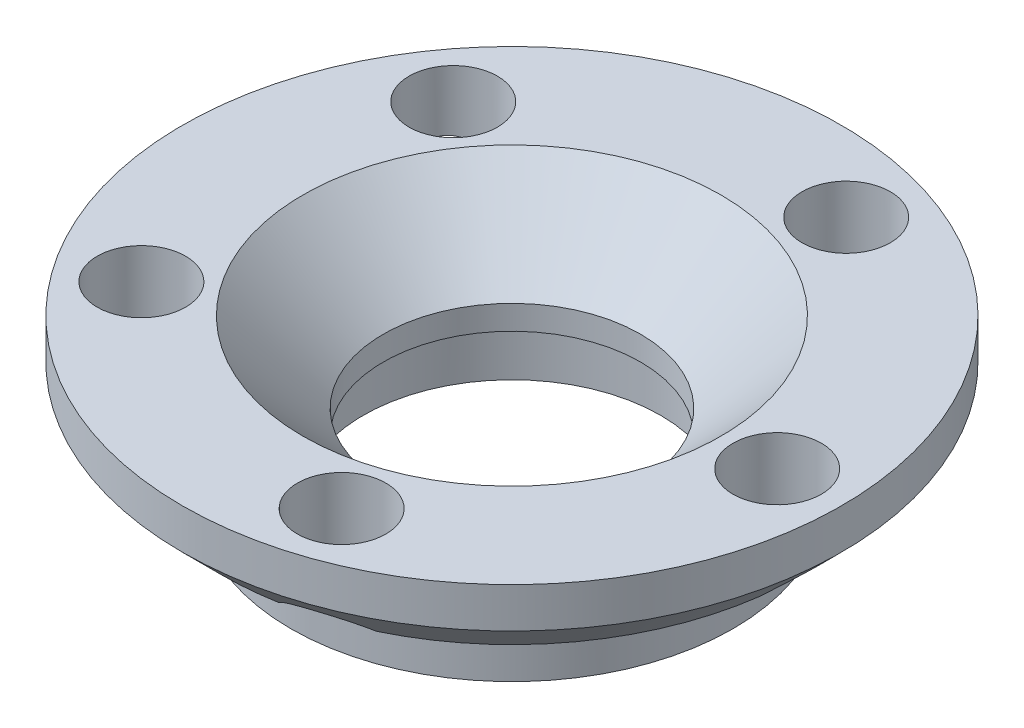
from build123d import *

# Parameters (mm, degrees)
SKETCH1_R                = 41
SKETCH1_R_2              = 5.5
SKETCH1_R_3              = 25
BOSS_EXTRUDE1_DEPTH      = 10
SKETCH2_R                = 25
SKETCH2_R_2              = 22.5
BOSS_EXTRUDE2_DEPTH      = 10
BOSS_EXTRUDE4_DEPTH      = 10
BOSS_EXTRUDE4_DEPTH_BACK = 10
SKETCH4_R                = 27.5
SKETCH4_R_2              = 19.5
SKETCH4_R_3              = 3
BOSS_EXTRUDE5_START      = -10
BOSS_EXTRUDE5_DEPTH      = 10
BOSS_EXTRUDE6_START      = -10
SKETCH6_R                = 3
BOSS_EXTRUDE6_DEPTH      = 5
CHAMFER2_SIZE            = 5
BOSS_EXTRUDE7_START      = -20
SKETCH7_R                = 19.5
SKETCH7_R_2              = 18.5
BOSS_EXTRUDE7_DEPTH      = 20
SKETCH8_R                = 18.5
SKETCH8_R_2              = 16
BOSS_EXTRUDE8_DEPTH      = 13
CHAMFER4_SIZE            = 10


with BuildPart() as part:
    # Sketch1 → Boss-Extrude1 (new body)
    with BuildSketch(Plane(origin=(0, 0, 0), x_dir=(1, 0, 0), z_dir=(0, 1, 0))):
        with Locations(Location((0, 0, 0), (0, 0, 270))):
            Circle(SKETCH1_R)
        with Locations(Location((33, 0, 0), (0, 0, 270))):
            Circle(SKETCH1_R_2, mode=Mode.SUBTRACT)
        with Locations(Location((10.197560814, -31.384865038, 0), (0, 0, 270))):
            Circle(SKETCH1_R_2, mode=Mode.SUBTRACT)
        with Locations(Location((-26.697560814, -19.396913326, 0), (0, 0, 270))):
            Circle(SKETCH1_R_2, mode=Mode.SUBTRACT)
        with Locations(Location((-26.697560814, 19.396913326, 0), (0, 0, 270))):
            Circle(SKETCH1_R_2, mode=Mode.SUBTRACT)
        with Locations(Location((10.197560814, 31.384865038, 0), (0, 0, 270))):
            Circle(SKETCH1_R_2, mode=Mode.SUBTRACT)
        with Locations(Location((0, 0, 0), (0, 0, 270))):
            Circle(SKETCH1_R_3, mode=Mode.SUBTRACT)
    extrude(amount=BOSS_EXTRUDE1_DEPTH)

    # Sketch2 → Boss-Extrude2 (add)
    with BuildSketch(Plane.XZ):
        Circle(SKETCH2_R)
        with Locations(Location((0, 0, 0), (0, 0, 270))):
            Circle(SKETCH2_R_2, mode=Mode.SUBTRACT)
    extrude(amount=-BOSS_EXTRUDE2_DEPTH)

    # Sketch4 → Boss-Extrude4 (add, two sides: drawn at the far end of the back side and taken through both)
    with BuildSketch(Plane.XZ.offset(-BOSS_EXTRUDE4_DEPTH_BACK)):
        with Locations(Location((0, 0, 0), (0, 0, 270))):
            Circle(SKETCH4_R)
        with Locations(Location((0, 0, 0), (0, 0, 270))):
            Circle(SKETCH4_R_2, mode=Mode.SUBTRACT)
        with Locations(Location((23.5, 0, 0), (0, 0, 270))):
            Circle(SKETCH4_R_3, mode=Mode.SUBTRACT)
        with Locations(Location((11.75, -20.351596989, 0), (0, 0, 270))):
            Circle(SKETCH4_R_3, mode=Mode.SUBTRACT)
        with Locations(Location((-11.75, -20.351596989, 0), (0, 0, 270))):
            Circle(SKETCH4_R_3, mode=Mode.SUBTRACT)
        with Locations(Location((-23.5, 0, 0), (0, 0, 270))):
            Circle(SKETCH4_R_3, mode=Mode.SUBTRACT)
        with Locations(Location((-11.75, 20.351596989, 0), (0, 0, 270))):
            Circle(SKETCH4_R_3, mode=Mode.SUBTRACT)
        with Locations(Location((11.75, 20.351596989, 0), (0, 0, 270))):
            Circle(SKETCH4_R_3, mode=Mode.SUBTRACT)
    extrude(amount=BOSS_EXTRUDE4_DEPTH + BOSS_EXTRUDE4_DEPTH_BACK)

    # Sketch5 → Boss-Extrude5 (add)
    with BuildSketch(Plane(origin=(0, 10, 0), x_dir=(1, 0, 0), z_dir=(0, 1, 0)).offset(BOSS_EXTRUDE5_START)):
        with BuildLine():
            ThreePointArc((-13.557162741, 17.956985783), (-10.25, 17.753520778), (-8.772624493, 20.719340229))
            ThreePointArc((-8.772624493, 20.719340229), (-11.25, 19.485571585), (-13.557162741, 17.956985783))
        make_face()
        with BuildLine():
            ThreePointArc((-22.329787234, 2.762354445), (-22.5, 0), (-22.329787234, -2.762354445))
            ThreePointArc((-22.329787234, -2.762354445), (-20.5, 0), (-22.329787234, 2.762354445))
        make_face()
        with BuildLine():
            ThreePointArc((8.772624493, 20.719340229), (10.25, 17.753520778), (13.557162741, 17.956985783))
            ThreePointArc((13.557162741, 17.956985783), (11.25, 19.485571585), (8.772624493, 20.719340229))
        make_face()
        with BuildLine():
            ThreePointArc((22.329787234, 2.762354445), (20.5, 0), (22.329787234, -2.762354445))
            ThreePointArc((22.329787234, -2.762354445), (22.5, 0), (22.329787234, 2.762354445))
        make_face()
        with BuildLine():
            ThreePointArc((13.557162741, -17.956985783), (10.25, -17.753520778), (8.772624493, -20.719340229))
            ThreePointArc((8.772624493, -20.719340229), (11.25, -19.485571585), (13.557162741, -17.956985783))
        make_face()
        with BuildLine():
            ThreePointArc((-8.772624493, -20.719340229), (-10.25, -17.753520778), (-13.557162741, -17.956985783))
            ThreePointArc((-13.557162741, -17.956985783), (-11.25, -19.485571585), (-8.772624493, -20.719340229))
        make_face()
    extrude(amount=BOSS_EXTRUDE5_DEPTH)

    # Sketch6 → Boss-Extrude6 (add)
    with BuildSketch(Plane.XZ.offset(10).offset(BOSS_EXTRUDE6_START)):
        with Locations(Location((-23.5, 0, 0), (0, 0, 270))):
            Circle(SKETCH6_R)
        with Locations(Location((-11.75, 20.351596989, 0), (0, 0, 270))):
            Circle(SKETCH6_R)
        with Locations(Location((11.75, 20.351596989, 0), (0, 0, 270))):
            Circle(SKETCH6_R)
        with Locations(Location((23.5, 0, 0), (0, 0, 270))):
            Circle(SKETCH6_R)
        with Locations(Location((11.75, -20.351596989, 0), (0, 0, 270))):
            Circle(SKETCH6_R)
        with Locations(Location((-11.75, -20.351596989, 0), (0, 0, 270))):
            Circle(SKETCH6_R)
    extrude(amount=BOSS_EXTRUDE6_DEPTH)

    # Chamfer2
    # the kernel refuses this chamfer: 5 mm, written as the material it takes off along each edge
    with BuildSketch(Plane(origin=(0, 0, 0), x_dir=(0, 0, 1), z_dir=(-1, 0, 0))) as chamfer2_piece_1:
        Polygon((41, CHAMFER2_SIZE), (41 - CHAMFER2_SIZE, 0), (41, 0), align=None)
    revolve(axis=Axis((0, 0, 0), (0, 1, 0)), mode=Mode.SUBTRACT)

    # Sketch7 → Boss-Extrude7 (add)
    with BuildSketch(Plane.XZ.offset(10).offset(BOSS_EXTRUDE7_START)):
        Circle(SKETCH7_R)
        with Locations(Location((0, 0, 0), (0, 0, 270))):
            Circle(SKETCH7_R_2, mode=Mode.SUBTRACT)
    extrude(amount=BOSS_EXTRUDE7_DEPTH)

    # Sketch8 → Boss-Extrude8 (add)
    with BuildSketch(Plane(origin=(0, 10, 0), x_dir=(1, 0, 0), z_dir=(0, 1, 0))):
        with Locations(Location((0, 0, 0), (0, 0, 90))):
            Circle(SKETCH8_R)
        with Locations(Location((0, 0, 0), (0, 0, 270))):
            Circle(SKETCH8_R_2, mode=Mode.SUBTRACT)
    extrude(amount=-BOSS_EXTRUDE8_DEPTH)

    # Chamfer4
    chamfer4_edges = [part.edges().sort_by_distance(p)[0] for p in [
        (0, 10, -16),
    ]]
    chamfer(chamfer4_edges, length=CHAMFER4_SIZE)


solid = part.part
